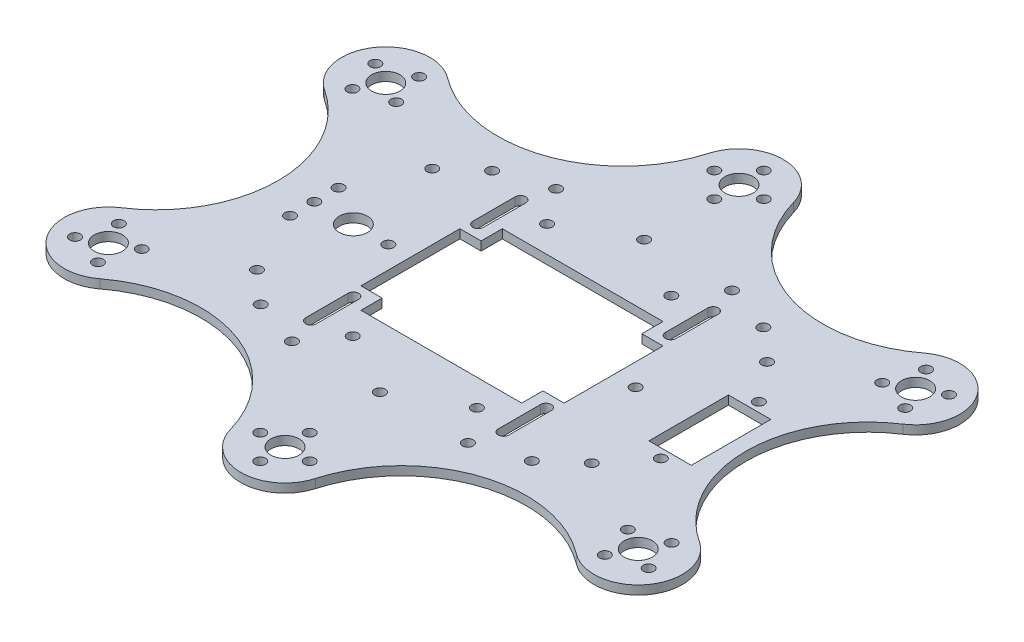
from build123d import *

# Parameters (mm, degrees)
SKETCH1_R           = 1.5
SKETCH1_R_2         = 4
SKETCH1_W           = 12
SKETCH1_H           = 22.5
BOSS_EXTRUDE1_DEPTH = 2.5


with BuildPart() as part:
    # Sketch1 → Boss-Extrude1 (new body)
    with BuildSketch(Plane(origin=(0, 0, 0), x_dir=(1, 0, 0), z_dir=(0, 1, 0))):
        with BuildLine():
            ThreePointArc((67.414732932, 49.203285306), (34.842613641, 43.81538777), (12.022120265, 67.673247628))
            ThreePointArc((12.022120265, 67.673247628), (0, 76.75), (-12.022120265, 67.673247628))
            ThreePointArc((-12.022120265, 67.673247628), (-34.842613641, 43.81538777), (-67.414732932, 49.203285306))
            ThreePointArc((-67.414732932, 49.203285306), (-85.189938198, 46.45680917), (-81.819417269, 28.789306741))
            ThreePointArc((-81.819417269, 28.789306741), (-66.25, 0), (-81.819417269, -28.789306741))
            ThreePointArc((-81.819417269, -28.789306741), (-85.189938198, -46.45680917), (-67.414732932, -49.203285306))
            ThreePointArc((-67.414732932, -49.203285306), (-34.842613641, -43.81538777), (-12.022120265, -67.673247628))
            ThreePointArc((-12.022120265, -67.673247628), (0, -76.75), (12.022120265, -67.673247628))
            ThreePointArc((12.022120265, -67.673247628), (34.842613641, -43.81538777), (67.414732932, -49.203285306))
            ThreePointArc((67.414732932, -49.203285306), (85.189938198, -46.45680917), (81.819417269, -28.789306741))
            ThreePointArc((81.819417269, -28.789306741), (66.25, 0), (81.819417269, 28.789306741))
            ThreePointArc((81.819417269, 28.789306741), (85.189938198, 46.45680917), (67.414732932, 49.203285306))
        make_face()
        with Locations((-81.178236772, -42.496525742)):
            Circle(SKETCH1_R, mode=Mode.SUBTRACT)
        with Locations((-71.730092644, -45.451618386)):
            Circle(SKETCH1_R, mode=Mode.SUBTRACT)
        with Locations((-74.976618386, -39.25)):
            Circle(SKETCH1_R_2, mode=Mode.SUBTRACT)
        with Locations((-7, -64.25)):
            Circle(SKETCH1_R, mode=Mode.SUBTRACT)
        with Locations((-78.223144128, -33.048381614)):
            Circle(SKETCH1_R, mode=Mode.SUBTRACT)
        with Locations((-68.775, -36.003474258)):
            Circle(SKETCH1_R, mode=Mode.SUBTRACT)
        with Locations((-47.375, -24.800648389)):
            Circle(SKETCH1_R, mode=Mode.SUBTRACT)
        with Locations((-55.95, -6.875)):
            Circle(SKETCH1_R, mode=Mode.SUBTRACT)
        with Locations((-38.375, -32.75)):
            Circle(SKETCH1_R, mode=Mode.SUBTRACT)
        with Locations((-24.9, -37.375)):
            Circle(SKETCH1_R, mode=Mode.SUBTRACT)
        with BuildLine():
            Line((-28.75, -29.65), (-28.75, -20))
            Line((-28.75, -20), (-28.75, -17.65))
            ThreePointArc((-28.75, -17.65), (-27.25, -16.15), (-25.75, -17.65))
            Line((-25.75, -17.65), (-25.75, -29.65))
            ThreePointArc((-25.75, -29.65), (-27.25, -31.15), (-28.75, -29.65))
        make_face(mode=Mode.SUBTRACT)
        with Locations((-17.575, -27.5)):
            Circle(SKETCH1_R, mode=Mode.SUBTRACT)
        with Locations((0, -71.25)):
            Circle(SKETCH1_R, mode=Mode.SUBTRACT)
        with Locations((0, -64.25)):
            Circle(SKETCH1_R_2, mode=Mode.SUBTRACT)
        with Locations((7, -64.25)):
            Circle(SKETCH1_R, mode=Mode.SUBTRACT)
        with Locations((0, -57.25)):
            Circle(SKETCH1_R, mode=Mode.SUBTRACT)
        with Locations((71.730092644, -45.451618386)):
            Circle(SKETCH1_R, mode=Mode.SUBTRACT)
        with Locations((74.976618386, -39.25)):
            Circle(SKETCH1_R_2, mode=Mode.SUBTRACT)
        with Locations((81.178236772, -42.496525742)):
            Circle(SKETCH1_R, mode=Mode.SUBTRACT)
        with Locations((0, -37.375)):
            Circle(SKETCH1_R, mode=Mode.SUBTRACT)
        with Locations((17.575, -27.5)):
            Circle(SKETCH1_R, mode=Mode.SUBTRACT)
        with Locations((24.9, -37.375)):
            Circle(SKETCH1_R, mode=Mode.SUBTRACT)
        with Locations((38.375, -32.75)):
            Circle(SKETCH1_R, mode=Mode.SUBTRACT)
        with BuildLine():
            Line((28.75, -17.65), (28.75, -20))
            Line((28.75, -20), (28.75, -29.65))
            ThreePointArc((28.75, -29.65), (27.25, -31.15), (25.75, -29.65))
            Line((25.75, -29.65), (25.75, -17.65))
            ThreePointArc((25.75, -17.65), (27.25, -16.15), (28.75, -17.65))
        make_face(mode=Mode.SUBTRACT)
        with Locations((47.375, -24.800648389)):
            Circle(SKETCH1_R, mode=Mode.SUBTRACT)
        with Locations((68.775, -36.003474258)):
            Circle(SKETCH1_R, mode=Mode.SUBTRACT)
        with Locations((78.223144128, -33.048381614)):
            Circle(SKETCH1_R, mode=Mode.SUBTRACT)
        with Locations((56, -13.875)):
            Circle(SKETCH1_R, mode=Mode.SUBTRACT)
        with Locations((-55.95, 0)):
            Circle(SKETCH1_R, mode=Mode.SUBTRACT)
        with Locations((-55.95, 6.875)):
            Circle(SKETCH1_R, mode=Mode.SUBTRACT)
        with Locations((-44.9, 0)):
            Circle(SKETCH1_R_2, mode=Mode.SUBTRACT)
        with Locations((-78.223144128, 33.048381614)):
            Circle(SKETCH1_R, mode=Mode.SUBTRACT)
        with Locations((-68.775, 36.003474258)):
            Circle(SKETCH1_R, mode=Mode.SUBTRACT)
        with Locations((-47.375, 24.800648389)):
            Circle(SKETCH1_R, mode=Mode.SUBTRACT)
        with Locations((-35, 0)):
            Circle(SKETCH1_R, mode=Mode.SUBTRACT)
        with BuildLine():
            Line((-28.75, 17.65), (-28.75, 20))
            Line((-28.75, 20), (-28.75, 29.65))
            ThreePointArc((-28.75, 29.65), (-27.25, 31.15), (-25.75, 29.65))
            Line((-25.75, 29.65), (-25.75, 17.65))
            ThreePointArc((-25.75, 17.65), (-27.25, 16.15), (-28.75, 17.65))
        make_face(mode=Mode.SUBTRACT)
        with Locations((-38.375, 32.75)):
            Circle(SKETCH1_R, mode=Mode.SUBTRACT)
        with Locations((-24.9, 37.375)):
            Circle(SKETCH1_R, mode=Mode.SUBTRACT)
        with Locations((-17.575, 27.5)):
            Circle(SKETCH1_R, mode=Mode.SUBTRACT)
        with Locations((-81.178236772, 42.496525742)):
            Circle(SKETCH1_R, mode=Mode.SUBTRACT)
        with Locations((-74.976618386, 39.25)):
            Circle(SKETCH1_R_2, mode=Mode.SUBTRACT)
        with Locations((-71.730092644, 45.451618386)):
            Circle(SKETCH1_R, mode=Mode.SUBTRACT)
        with Locations((-7, 64.25)):
            Circle(SKETCH1_R, mode=Mode.SUBTRACT)
        Polygon((-22.75, 14), (-22.75, 20), (22.75, 20), (22.75, 14), (28.75, 14), (28.75, -14), (22.75, -14), (22.75, -20), (-22.75, -20), (-22.75, -14), (-28.75, -14), (-28.75, 14), align=None, mode=Mode.SUBTRACT)
        with Locations((35, 0)):
            Circle(SKETCH1_R, mode=Mode.SUBTRACT)
        with Locations((17.575, 27.5)):
            Circle(SKETCH1_R, mode=Mode.SUBTRACT)
        with Locations((0, 37.375)):
            Circle(SKETCH1_R, mode=Mode.SUBTRACT)
        with BuildLine():
            ThreePointArc((28.75, 17.65), (27.25, 16.15), (25.75, 17.65))
            Line((25.75, 17.65), (25.75, 29.65))
            ThreePointArc((25.75, 29.65), (27.25, 31.15), (28.75, 29.65))
            Line((28.75, 29.65), (28.75, 20))
            Line((28.75, 20), (28.75, 17.65))
        make_face(mode=Mode.SUBTRACT)
        with Locations((24.9, 37.375)):
            Circle(SKETCH1_R, mode=Mode.SUBTRACT)
        with Locations((38.375, 32.75)):
            Circle(SKETCH1_R, mode=Mode.SUBTRACT)
        with Locations((56, 0)):
            Rectangle(SKETCH1_W, SKETCH1_H, mode=Mode.SUBTRACT)
        with Locations((56, 13.875)):
            Circle(SKETCH1_R, mode=Mode.SUBTRACT)
        with Locations((47.375, 24.800648389)):
            Circle(SKETCH1_R, mode=Mode.SUBTRACT)
        with Locations((68.775, 36.003474258)):
            Circle(SKETCH1_R, mode=Mode.SUBTRACT)
        with Locations((78.223144128, 33.048381614)):
            Circle(SKETCH1_R, mode=Mode.SUBTRACT)
        with Locations((0, 57.25)):
            Circle(SKETCH1_R, mode=Mode.SUBTRACT)
        with Locations((0, 64.25)):
            Circle(SKETCH1_R_2, mode=Mode.SUBTRACT)
        with Locations((7, 64.25)):
            Circle(SKETCH1_R, mode=Mode.SUBTRACT)
        with Locations((0, 71.25)):
            Circle(SKETCH1_R, mode=Mode.SUBTRACT)
        with Locations((74.976618386, 39.25)):
            Circle(SKETCH1_R_2, mode=Mode.SUBTRACT)
        with Locations((71.730092644, 45.451618386)):
            Circle(SKETCH1_R, mode=Mode.SUBTRACT)
        with Locations((81.178236772, 42.496525742)):
            Circle(SKETCH1_R, mode=Mode.SUBTRACT)
    extrude(amount=BOSS_EXTRUDE1_DEPTH)


solid = part.part
